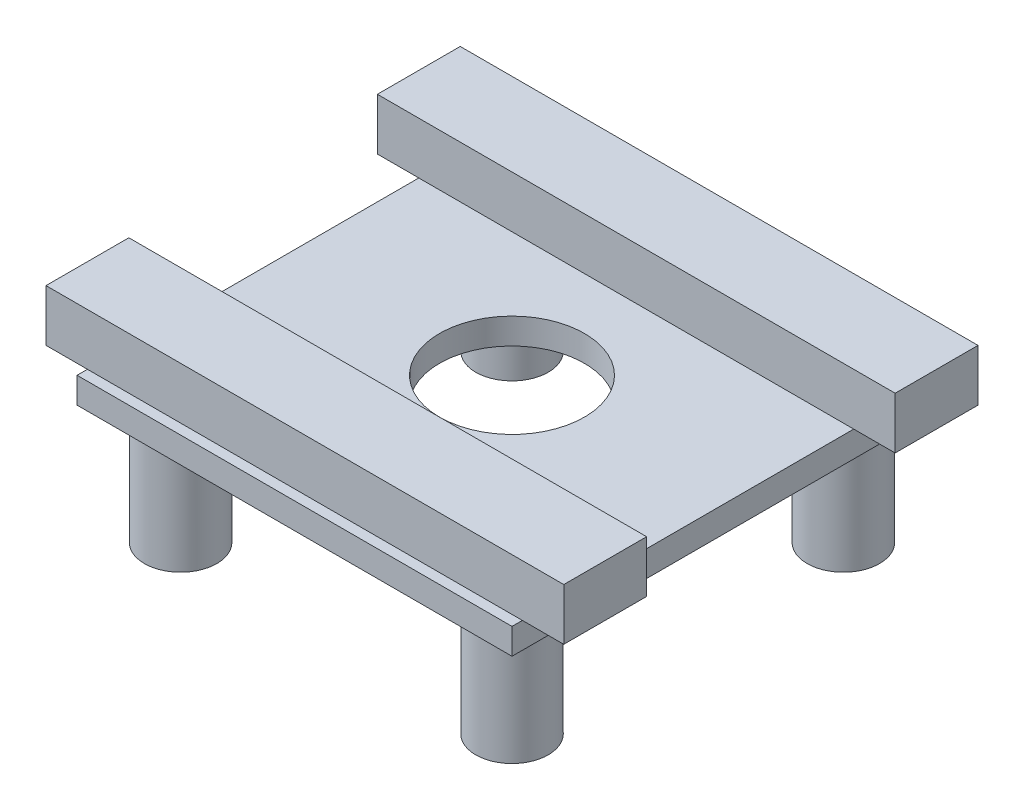
from build123d import *

# Parameters (mm, degrees)
SKETCH1_W           = 100000
SKETCH1_H           = 16000
BOSS_EXTRUDE1_DEPTH = 10000
SKETCH2_W           = 100000
SKETCH2_H           = 16000
BOSS_EXTRUDE2_DEPTH = 10000
SKETCH3_R           = 7000
BOSS_EXTRUDE3_DEPTH = 28000
SKETCH4_W           = 84000
SKETCH4_H           = 84000
SKETCH4_R           = 14000
BOSS_EXTRUDE4_DEPTH = 5000


with BuildPart() as part:
    # Sketch1 → Boss-Extrude1 (new body)
    with BuildSketch(Plane(origin=(0, 0, 0), x_dir=(1, 0, 0), z_dir=(0, 1, 0))):
        with Locations((0, -32000)):
            Rectangle(SKETCH1_W, SKETCH1_H)
    extrude(amount=BOSS_EXTRUDE1_DEPTH)



with BuildPart() as body_2:
    # Sketch2 → Boss-Extrude2 (new body)
    with BuildSketch(Plane(origin=(0, 0, 0), x_dir=(1, 0, 0), z_dir=(0, 1, 0))):
        with Locations((0, 32000)):
            Rectangle(SKETCH2_W, SKETCH2_H)
    extrude(amount=BOSS_EXTRUDE2_DEPTH)


with BuildPart() as part_1:
    add(part.part)

    add(body_2.part)  # Boss-Extrude3 merges body 2
    # Sketch3 → Boss-Extrude3 (add)
    with BuildSketch(Plane(origin=(0, 0, 0), x_dir=(1, 0, 0), z_dir=(0, 1, 0))):
        with Locations((-32000, -32000)):
            Circle(SKETCH3_R)
        with Locations((32000, -32000)):
            Circle(SKETCH3_R)
        with Locations((-32000, 32000)):
            Circle(SKETCH3_R)
        with Locations((32000, 32000)):
            Circle(SKETCH3_R)
    extrude(amount=-BOSS_EXTRUDE3_DEPTH)

    # Sketch4 → Boss-Extrude4 (add)
    with BuildSketch(Plane(origin=(0, 0, 0), x_dir=(1, 0, 0), z_dir=(0, 1, 0))):
        Rectangle(SKETCH4_W, SKETCH4_H)
        Circle(SKETCH4_R, mode=Mode.SUBTRACT)
    extrude(amount=-BOSS_EXTRUDE4_DEPTH)


solid = part_1.part
